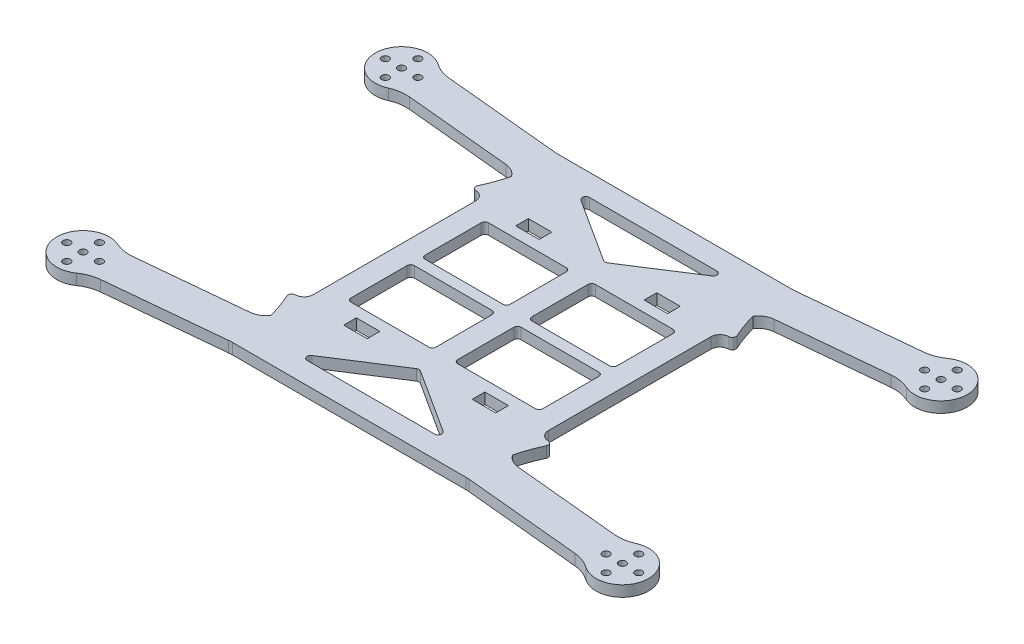
from build123d import *

# Parameters (mm, degrees)
SKETCH1_R           = 0.999999997
SKETCH1_R_2         = 1
SKETCH1_R_3         = 1.000000001
SKETCH1_R_4         = 0.999999999
SKETCH1_R_5         = 1.000000003
BOSS_EXTRUDE1_DEPTH = 3
SKETCH2_W           = 6.5
SKETCH2_H           = 3.5
CUT_EXTRUDE1_DEPTH  = 3


with BuildPart() as part:
    # Sketch1 → Boss-Extrude1 (new body)
    with BuildSketch(Plane(origin=(0, 0, 0), x_dir=(1, 0, 0), z_dir=(0, 1, 0))):
        with BuildLine():
            Line((-33.218669872, 45.046086874), (-65.541413555, 48.16007559))
            ThreePointArc((-65.541413555, 48.16007559), (-68.051615849, 48.735029299), (-70.331753828, 49.931966272))
            ThreePointArc((-70.331753828, 49.931966272), (-81.716587017, 44.695249474), (-71.540883348, 37.381380156))
            ThreePointArc((-71.540883348, 37.381380156), (-69.074176187, 38.121003778), (-66.500378347, 38.206162463))
            Line((-66.500378347, 38.206162463), (-37.020517604, 35.366058461))
            ThreePointArc((-37.020517604, 35.366058461), (-34.967820887, 34.700490182), (-33.386772404, 33.231874971))
            ThreePointArc((-33.386772404, 33.231874971), (-34.463229219, 29.741424145), (-35.835420758, 26.3562954))
            ThreePointArc((-35.835420758, 26.3562954), (-35.77253489, 25.409347753), (-34.946904251, 24.941374967))
            ThreePointArc((-34.946904251, 24.941374967), (-33.213559493, 24.190832889), (-32.5, 22.441938863))
            Line((-32.5, 22.441938863), (-32.5, -22.441938863))
            ThreePointArc((-32.5, -22.441938863), (-33.213559493, -24.190832889), (-34.946904251, -24.941374967))
            ThreePointArc((-34.946904251, -24.941374967), (-35.77253489, -25.409347753), (-35.835420758, -26.3562954))
            ThreePointArc((-35.835420758, -26.3562954), (-34.463229219, -29.741424145), (-33.386772404, -33.231874971))
            ThreePointArc((-33.386772404, -33.231874971), (-34.967820887, -34.700490182), (-37.020517604, -35.366058461))
            Line((-37.020517604, -35.366058461), (-66.500378347, -38.206162463))
            ThreePointArc((-66.500378347, -38.206162463), (-69.074176187, -38.121003778), (-71.540883348, -37.381380156))
            ThreePointArc((-71.540883348, -37.381380156), (-81.716587017, -44.695249474), (-70.331753828, -49.931966272))
            ThreePointArc((-70.331753828, -49.931966272), (-68.051615849, -48.735029299), (-65.541413555, -48.16007559))
            Line((-65.541413555, -48.16007559), (-33.218669872, -45.046086874))
            ThreePointArc((-33.218669872, -45.046086874), (-32.739740879, -45.011528364), (-32.25970508, -45))
            Line((-32.25970508, -45), (32.25970508, -45))
            ThreePointArc((32.25970508, -45), (32.739740879, -45.011528364), (33.218669872, -45.046086874))
            Line((33.218669872, -45.046086874), (65.541413555, -48.16007559))
            ThreePointArc((65.541413555, -48.16007559), (68.051615849, -48.735029299), (70.331753828, -49.931966272))
            ThreePointArc((70.331753828, -49.931966272), (81.716587017, -44.695249474), (71.540883348, -37.381380156))
            ThreePointArc((71.540883348, -37.381380156), (69.074176187, -38.121003778), (66.500378347, -38.206162463))
            Line((66.500378347, -38.206162463), (37.020517604, -35.366058461))
            ThreePointArc((37.020517604, -35.366058461), (34.967820887, -34.700490182), (33.386772404, -33.231874971))
            ThreePointArc((33.386772404, -33.231874971), (34.463229219, -29.741424145), (35.835420758, -26.3562954))
            ThreePointArc((35.835420758, -26.3562954), (35.77253489, -25.409347753), (34.946904251, -24.941374967))
            ThreePointArc((34.946904251, -24.941374967), (33.213559493, -24.190832889), (32.5, -22.441938863))
            Line((32.5, -22.441938863), (32.5, 22.441938863))
            ThreePointArc((32.5, 22.441938863), (33.213559493, 24.190832889), (34.946904251, 24.941374967))
            ThreePointArc((34.946904251, 24.941374967), (35.77253489, 25.409347753), (35.835420758, 26.3562954))
            ThreePointArc((35.835420758, 26.3562954), (34.463229219, 29.741424145), (33.386772404, 33.231874971))
            ThreePointArc((33.386772404, 33.231874971), (34.967820887, 34.700490182), (37.020517604, 35.366058461))
            Line((37.020517604, 35.366058461), (66.500378347, 38.206162463))
            ThreePointArc((66.500378347, 38.206162463), (69.074176187, 38.121003778), (71.540883348, 37.381380156))
            ThreePointArc((71.540883348, 37.381380156), (81.716587017, 44.695249474), (70.331753828, 49.931966272))
            ThreePointArc((70.331753828, 49.931966272), (68.051615849, 48.735029299), (65.541413555, 48.16007559))
            Line((65.541413555, 48.16007559), (33.218669872, 45.046086874))
            ThreePointArc((33.218669872, 45.046086874), (32.739740879, 45.011528364), (32.25970508, 45))
            Line((32.25970508, 45), (-32.25970508, 45))
            ThreePointArc((-32.25970508, 45), (-32.739740879, 45.011528364), (-33.218669872, 45.046086874))
        make_face()
        with Locations((-74.500002545, -48.500002545)):
            Circle(SKETCH1_R, mode=Mode.SUBTRACT)
        with Locations((-79, -44)):
            Circle(SKETCH1_R_2, mode=Mode.SUBTRACT)
        with Locations((-74.5, -44)):
            Circle(SKETCH1_R_2, mode=Mode.SUBTRACT)
        with Locations((-74.499997455, -39.500002545)):
            Circle(SKETCH1_R_3, mode=Mode.SUBTRACT)
        with Locations((-70, -44.00000509)):
            Circle(SKETCH1_R_4, mode=Mode.SUBTRACT)
        with Locations((74.500002545, -48.500002545)):
            Circle(SKETCH1_R_3, mode=Mode.SUBTRACT)
        with Locations((70, -44.00000509)):
            Circle(SKETCH1_R_4, mode=Mode.SUBTRACT)
        with Locations((74.5, -44)):
            Circle(SKETCH1_R_2, mode=Mode.SUBTRACT)
        with Locations((79, -44)):
            Circle(SKETCH1_R_2, mode=Mode.SUBTRACT)
        with Locations((74.499997455, -39.500002545)):
            Circle(SKETCH1_R, mode=Mode.SUBTRACT)
        with Locations((-74.499997455, 39.500002545)):
            Circle(SKETCH1_R_5, mode=Mode.SUBTRACT)
        with Locations((-79, 44)):
            Circle(SKETCH1_R_2, mode=Mode.SUBTRACT)
        with Locations((-74.5, 44)):
            Circle(SKETCH1_R_2, mode=Mode.SUBTRACT)
        with Locations((-70, 44.00000509)):
            Circle(SKETCH1_R_3, mode=Mode.SUBTRACT)
        with Locations((-74.500002545, 48.500002545)):
            Circle(SKETCH1_R_4, mode=Mode.SUBTRACT)
        with Locations((70, 44.00000509)):
            Circle(SKETCH1_R_3, mode=Mode.SUBTRACT)
        with Locations((74.499997455, 39.500002545)):
            Circle(SKETCH1_R_4, mode=Mode.SUBTRACT)
        with Locations((74.5, 44)):
            Circle(SKETCH1_R_2, mode=Mode.SUBTRACT)
        with Locations((79, 44)):
            Circle(SKETCH1_R_2, mode=Mode.SUBTRACT)
        with Locations((74.500002545, 48.500002545)):
            Circle(SKETCH1_R_5, mode=Mode.SUBTRACT)
    extrude(amount=BOSS_EXTRUDE1_DEPTH)

    # Sketch2 → Cut-Extrude1 (cut)
    with BuildSketch(Plane(origin=(0, 3, 0), x_dir=(1, 0, 0), z_dir=(0, 1, 0))):
        with Locations((-17.75, 23.75)):
            Rectangle(SKETCH2_W, SKETCH2_H)
        with Locations((-17.75, -23.75)):
            Rectangle(SKETCH2_W, SKETCH2_H)
        with Locations((17.75, -23.75)):
            Rectangle(SKETCH2_W, SKETCH2_H)
        with Locations((17.75, 23.75)):
            Rectangle(SKETCH2_W, SKETCH2_H)
        with BuildLine():
            Line((-25.5, 19), (-4, 19))
            ThreePointArc((-4, 19), (-3.292893219, 18.707106781), (-3, 18))
            Line((-3, 18), (-3, 2.5))
            ThreePointArc((-3, 2.5), (-3.292893219, 1.792893219), (-4, 1.5))
            Line((-4, 1.5), (-25.5, 1.5))
            ThreePointArc((-25.5, 1.5), (-26.207106781, 1.792893219), (-26.5, 2.5))
            Line((-26.5, 2.5), (-26.5, 18))
            ThreePointArc((-26.5, 18), (-26.207106781, 18.707106781), (-25.5, 19))
        make_face()
        with BuildLine():
            Line((-25.5, -1.5), (-4, -1.5))
            ThreePointArc((-4, -1.5), (-3.292893219, -1.792893219), (-3, -2.5))
            Line((-3, -2.5), (-3, -18))
            ThreePointArc((-3, -18), (-3.292893219, -18.707106781), (-4, -19))
            Line((-4, -19), (-25.5, -19))
            ThreePointArc((-25.5, -19), (-26.207106781, -18.707106781), (-26.5, -18))
            Line((-26.5, -18), (-26.5, -2.5))
            ThreePointArc((-26.5, -2.5), (-26.207106781, -1.792893219), (-25.5, -1.5))
        make_face()
        with BuildLine():
            Line((4, 19), (25.5, 19))
            ThreePointArc((25.5, 19), (26.207106781, 18.707106781), (26.5, 18))
            Line((26.5, 18), (26.5, 2.5))
            ThreePointArc((26.5, 2.5), (26.207106781, 1.792893219), (25.5, 1.5))
            Line((25.5, 1.5), (4, 1.5))
            ThreePointArc((4, 1.5), (3.292893219, 1.792893219), (3, 2.5))
            Line((3, 2.5), (3, 18))
            ThreePointArc((3, 18), (3.292893219, 18.707106781), (4, 19))
        make_face()
        with BuildLine():
            Line((4, -1.5), (25.5, -1.5))
            ThreePointArc((25.5, -1.5), (26.207106781, -1.792893219), (26.5, -2.5))
            Line((26.5, -2.5), (26.5, -18))
            ThreePointArc((26.5, -18), (26.207106781, -18.707106781), (25.5, -19))
            Line((25.5, -19), (4, -19))
            ThreePointArc((4, -19), (3.292893219, -18.707106781), (3, -18))
            Line((3, -18), (3, -2.5))
            ThreePointArc((3, -2.5), (3.292893219, -1.792893219), (4, -1.5))
        make_face()
        with BuildLine():
            Line((-17.595187003, 39), (17.595187003, 39))
            ThreePointArc((17.595187003, 39), (18.554660419, 38.281799152), (18.135944594, 37.158821525))
            Line((18.135944594, 37.158821525), (0.540757591, 25.84762988))
            ThreePointArc((0.540757591, 25.84762988), (0, 25.688808356), (-0.540757591, 25.84762988))
            Line((-0.540757591, 25.84762988), (-18.135944594, 37.158821525))
            ThreePointArc((-18.135944594, 37.158821525), (-18.554660419, 38.281799152), (-17.595187003, 39))
        make_face()
        with BuildLine():
            Line((-17.595187003, -39), (17.595187003, -39))
            ThreePointArc((17.595187003, -39), (18.554660419, -38.281799152), (18.135944594, -37.158821525))
            Line((18.135944594, -37.158821525), (0.540757591, -25.84762988))
            ThreePointArc((0.540757591, -25.84762988), (0, -25.688808356), (-0.540757591, -25.84762988))
            Line((-0.540757591, -25.84762988), (-18.135944594, -37.158821525))
            ThreePointArc((-18.135944594, -37.158821525), (-18.554660419, -38.281799152), (-17.595187003, -39))
        make_face()
    extrude(amount=-CUT_EXTRUDE1_DEPTH, mode=Mode.SUBTRACT)


solid = part.part
